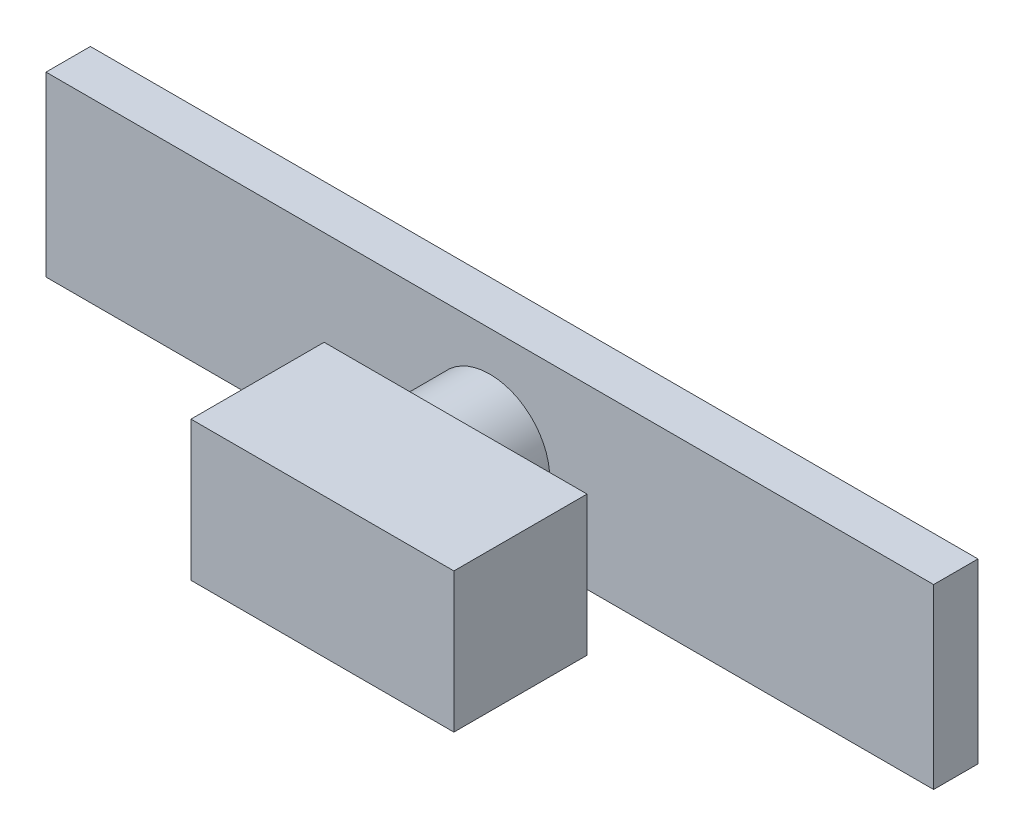
from build123d import *

# Parameters (mm, degrees)
SKETCH2_W             = 254
SKETCH2_H             = 12.7
BOSS_EXTRUDE1_DEPTH   = 50.8
SKETCH3_R             = 17.140791438
BOSS_EXTRUDE2_DEPTH   = 19.05
SKETCH4_W             = 75.235944222
SKETCH4_H             = 39.955088207
BOSS_EXTRUDE3_DEPTH   = 38.1
SCALE2_SCALE          = 0.06
BODY_MOVE_COPY1_ANGLE = 90
SCALE5_SCALE          = 0.25


with BuildPart() as part:
    # Sketch2 → Boss-Extrude1 (new body)
    with BuildSketch(Plane.XY):
        with Locations((79.130769231, 14.898076923)):
            Rectangle(SKETCH2_W, SKETCH2_H)
    extrude(amount=BOSS_EXTRUDE1_DEPTH)

    # Sketch3 → Boss-Extrude2 (add)
    with BuildSketch(Plane(origin=(0, 21.248076923, 0), x_dir=(1, 0, 0), z_dir=(0, 1, 0))):
        with Locations((79.130769231, -28.483063876)):
            Circle(SKETCH3_R)
    extrude(amount=BOSS_EXTRUDE2_DEPTH)

    # Sketch4 → Boss-Extrude3 (add)
    with BuildSketch(Plane(origin=(0, 40.298076923, 0), x_dir=(1, 0, 0), z_dir=(0, 1, 0))):
        with Locations((88.38546847, -28.088530296)):
            Rectangle(SKETCH4_W, SKETCH4_H)
    extrude(amount=BOSS_EXTRUDE3_DEPTH)


with BuildPart() as part_1:
    # Scale2: scaled about (82.711857342, 33.041003565, 26.623476887)
    add(part.part.scale(SCALE2_SCALE).moved(Location((77.749145901, 31.058543351, 25.026068274))))


with BuildPart() as part_2:
    # Body-Move/Copy1: moved
    add(part_1.part.rotate(Axis((0, 33.666927966, 26.550068274), (1, 0, 0)), BODY_MOVE_COPY1_ANGLE))


with BuildPart() as part_3:
    # Body-Move/Copy3: moved
    add(part_2.part.moved(Location((-50.8, 0, -50.8))))


with BuildPart() as part_4:
    # Scale5: scaled about (31.911857342, 33.593519353, -24.875856127)
    add(part_3.part.scale(SCALE5_SCALE).moved(Location((23.933893006, 25.195139515, -18.656892095))))


solid = part_4.part
